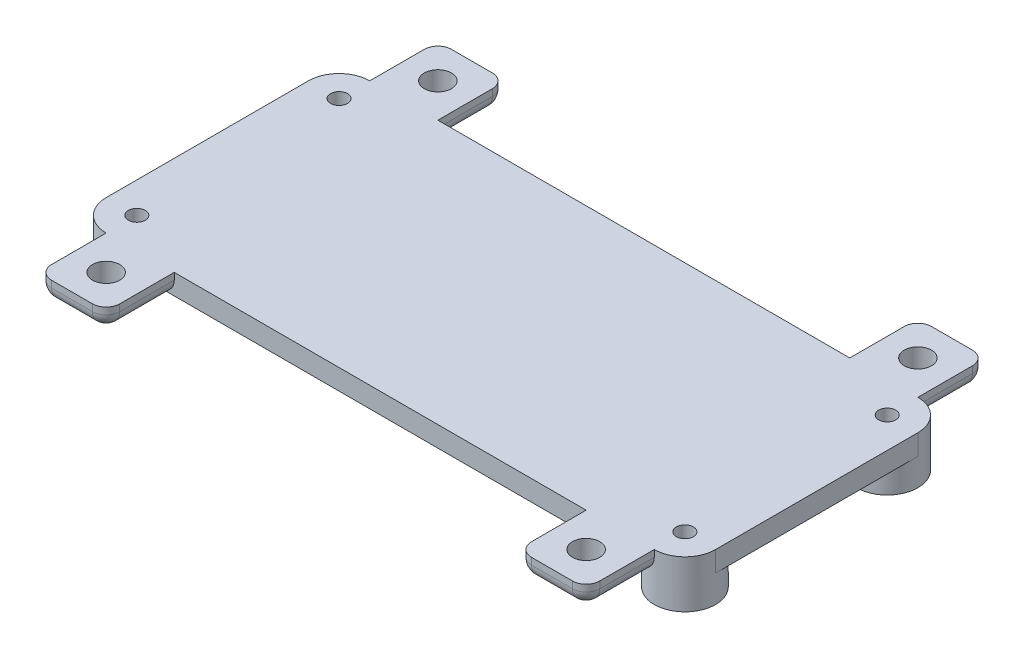
from build123d import *

# Parameters (mm, degrees)
SKETCH1_R           = 1.25
BOSS_EXTRUDE1_DEPTH = 4
BOSS_EXTRUDE2_DEPTH = 3
SKETCH1_3_R         = 1.25
CUT_EXTRUDE1_DEPTH  = 7
SKETCH3_W           = 10
SKETCH3_H           = 3
BOSS_EXTRUDE3_DEPTH = 10
BOSS_EXTRUDE4_START = -38.69
SKETCH3_2_W         = 10
SKETCH3_2_H         = 3
BOSS_EXTRUDE4_DEPTH = 10
FILLET1_R           = 2
FILLET2_R           = 2
CUT_EXTRUDE2_REACH  = 101.465
SKETCH4_R           = 2


with BuildPart() as part:
    # Sketch1 → Boss-Extrude1 (new body)
    # profile 1 of 8: a face of its own
    with BuildSketch(Plane(origin=(0, 0, 0), x_dir=(1, 0, 0), z_dir=(0, 1, 0))):
        with BuildLine():
            ThreePointArc((-78.345, -2.875), (-78.612488616, -1.346652073), (-79.383154394, 0))
            Line((-79.383154394, 0), (-85.4, 0))
            Line((-85.4, 0), (-85.4, -6.579318426))
            ThreePointArc((-85.4, -6.579318426), (-80.753051148, -6.859187496), (-78.345, -2.875))
        make_face()
        with Locations(Location((-82.845, -2.875, 0), (0, 0, 270))):
            Circle(SKETCH1_R, mode=Mode.SUBTRACT)
    # profile 2 of 8: a face of its own
    with BuildSketch(Plane(origin=(0, 0, 0), x_dir=(1, 0, 0), z_dir=(0, 1, 0))):
        with BuildLine():
            Line((-85.4, 0), (-79.383154394, 0))
            ThreePointArc((-79.383154394, 0), (-86.165760451, 0.161865164), (-85.4, -6.579318426))
            Line((-85.4, -6.579318426), (-85.4, 0))
        make_face()
    # profile 3 of 8: a face of its own
    with BuildSketch(Plane(origin=(0, 0, 0), x_dir=(1, 0, 0), z_dir=(0, 1, 0))):
        with BuildLine():
            Line((-85.4, -35.22), (-85.4, -28.860681574))
            ThreePointArc((-85.4, -28.860681574), (-86.070046249, -35.703323867), (-79.211685398, -35.22))
            Line((-79.211685398, -35.22), (-85.4, -35.22))
        make_face()
    # profile 4 of 8: a face of its own
    with BuildSketch(Plane(origin=(0, 0, 0), x_dir=(1, 0, 0), z_dir=(0, 1, 0))):
        with BuildLine():
            ThreePointArc((-78.345, -32.565), (-80.753051148, -28.580812504), (-85.4, -28.860681574))
            Line((-85.4, -28.860681574), (-85.4, -35.22))
            Line((-85.4, -35.22), (-79.211685398, -35.22))
            ThreePointArc((-79.211685398, -35.22), (-78.567154999, -33.961439094), (-78.345, -32.565))
        make_face()
        with Locations(Location((-82.845, -32.565, 0), (0, 0, 270))):
            Circle(SKETCH1_R, mode=Mode.SUBTRACT)
    # profile 5 of 8: a face of its own
    with BuildSketch(Plane(origin=(0, 0, 0), x_dir=(1, 0, 0), z_dir=(0, 1, 0))):
        with BuildLine():
            Line((0, -35.22), (0, -28.755278882))
            ThreePointArc((0, -28.755278882), (-5.68612603, -29.496044241), (-6.028314602, -35.22))
            Line((-6.028314602, -35.22), (0, -35.22))
        make_face()
        with Locations(Location((-2.395, -32.565, 0), (0, 0, 270))):
            Circle(SKETCH1_R, mode=Mode.SUBTRACT)
    # profile 6 of 8: a face of its own
    with BuildSketch(Plane(origin=(0, 0, 0), x_dir=(1, 0, 0), z_dir=(0, 1, 0))):
        with BuildLine():
            ThreePointArc((2.105, -32.565), (1.543749802, -30.388707281), (0, -28.755278882))
            Line((0, -28.755278882), (0, -35.22))
            Line((0, -35.22), (-6.028314602, -35.22))
            ThreePointArc((-6.028314602, -35.22), (-0.998560906, -36.842845001), (2.105, -32.565))
        make_face()
    # profile 7 of 8: a face of its own
    with BuildSketch(Plane(origin=(0, 0, 0), x_dir=(1, 0, 0), z_dir=(0, 1, 0))):
        with BuildLine():
            Line((0, -6.684721118), (0, 0))
            Line((0, 0), (-5.856845606, 0))
            ThreePointArc((-5.856845606, 0), (-5.779658623, -5.840482424), (0, -6.684721118))
        make_face()
        with Locations(Location((-2.395, -2.875, 0), (0, 0, 270))):
            Circle(SKETCH1_R, mode=Mode.SUBTRACT)
    # profile 8 of 8: a face of its own
    with BuildSketch(Plane(origin=(0, 0, 0), x_dir=(1, 0, 0), z_dir=(0, 1, 0))):
        with BuildLine():
            Line((-5.856845606, 0), (0, 0))
            Line((0, 0), (0, -6.684721118))
            ThreePointArc((0, -6.684721118), (1.543749802, -5.051292719), (2.105, -2.875))
            ThreePointArc((2.105, -2.875), (-0.866652073, 1.357511384), (-5.856845606, 0))
        make_face()
    extrude(amount=BOSS_EXTRUDE1_DEPTH)

    # Sketch2 → Boss-Extrude2 (add)
    with BuildSketch(Plane(origin=(0, 4, 0), x_dir=(1, 0, 0), z_dir=(0, 1, 0))):
        with BuildLine():
            Line((-2.395, 1.625), (-82.845, 1.625))
            ThreePointArc((-82.845, 1.625), (-79.663019485, 0.306980515), (-78.345, -2.875))
            Line((-78.345, -2.875), (-6.895, -2.875))
            ThreePointArc((-6.895, -2.875), (-5.576980515, 0.306980515), (-2.395, 1.625))
        make_face()
        with BuildLine():
            ThreePointArc((-78.345, -2.875), (-79.663019485, 0.306980515), (-82.845, 1.625))
            Line((-82.845, 1.625), (-82.845, -1.625))
            ThreePointArc((-82.845, -1.625), (-81.961116524, -1.991116524), (-81.595, -2.875))
            Line((-81.595, -2.875), (-78.345, -2.875))
        make_face()
        with BuildLine():
            Line((-82.845, -1.625), (-82.845, 1.625))
            ThreePointArc((-82.845, 1.625), (-86.026980515, 0.306980515), (-87.345, -2.875))
            Line((-87.345, -2.875), (-84.095, -2.875))
            ThreePointArc((-84.095, -2.875), (-83.728883476, -1.991116524), (-82.845, -1.625))
        make_face()
        with BuildLine():
            ThreePointArc((-82.845, -7.375), (-79.663019485, -6.056980515), (-78.345, -2.875))
            Line((-78.345, -2.875), (-81.595, -2.875))
            ThreePointArc((-81.595, -2.875), (-81.961116524, -3.758883476), (-82.845, -4.125))
            Line((-82.845, -4.125), (-82.845, -7.375))
        make_face()
        with BuildLine():
            Line((-84.095, -2.875), (-87.345, -2.875))
            ThreePointArc((-87.345, -2.875), (-86.026980515, -6.056980515), (-82.845, -7.375))
            Line((-82.845, -7.375), (-82.845, -4.125))
            ThreePointArc((-82.845, -4.125), (-83.728883476, -3.758883476), (-84.095, -2.875))
        make_face()
        with BuildLine():
            ThreePointArc((-78.345, -2.875), (-79.663019485, 0.306980515), (-82.845, 1.625))
            Line((-82.845, 1.625), (-82.845, -1.625))
            ThreePointArc((-82.845, -1.625), (-81.961116524, -1.991116524), (-81.595, -2.875))
            Line((-81.595, -2.875), (-78.345, -2.875))
        make_face()
        with BuildLine():
            Line((-82.845, -1.625), (-82.845, 1.625))
            ThreePointArc((-82.845, 1.625), (-86.026980515, 0.306980515), (-87.345, -2.875))
            Line((-87.345, -2.875), (-84.095, -2.875))
            ThreePointArc((-84.095, -2.875), (-83.728883476, -1.991116524), (-82.845, -1.625))
        make_face()
        with BuildLine():
            ThreePointArc((-82.845, -7.375), (-79.663019485, -6.056980515), (-78.345, -2.875))
            Line((-78.345, -2.875), (-81.595, -2.875))
            ThreePointArc((-81.595, -2.875), (-81.961116524, -3.758883476), (-82.845, -4.125))
            Line((-82.845, -4.125), (-82.845, -7.375))
        make_face()
        with BuildLine():
            Line((-84.095, -2.875), (-87.345, -2.875))
            ThreePointArc((-87.345, -2.875), (-86.026980515, -6.056980515), (-82.845, -7.375))
            Line((-82.845, -7.375), (-82.845, -4.125))
            ThreePointArc((-82.845, -4.125), (-83.728883476, -3.758883476), (-84.095, -2.875))
        make_face()
        with BuildLine():
            ThreePointArc((-78.345, -2.875), (-79.663019485, 0.306980515), (-82.845, 1.625))
            Line((-82.845, 1.625), (-82.845, -1.625))
            ThreePointArc((-82.845, -1.625), (-81.961116524, -1.991116524), (-81.595, -2.875))
            Line((-81.595, -2.875), (-78.345, -2.875))
        make_face()
        with BuildLine():
            Line((-82.845, -1.625), (-82.845, 1.625))
            ThreePointArc((-82.845, 1.625), (-86.026980515, 0.306980515), (-87.345, -2.875))
            Line((-87.345, -2.875), (-84.095, -2.875))
            ThreePointArc((-84.095, -2.875), (-83.728883476, -1.991116524), (-82.845, -1.625))
        make_face()
        with BuildLine():
            ThreePointArc((-82.845, -7.375), (-79.663019485, -6.056980515), (-78.345, -2.875))
            Line((-78.345, -2.875), (-81.595, -2.875))
            ThreePointArc((-81.595, -2.875), (-81.961116524, -3.758883476), (-82.845, -4.125))
            Line((-82.845, -4.125), (-82.845, -7.375))
        make_face()
        with BuildLine():
            Line((-84.095, -2.875), (-87.345, -2.875))
            ThreePointArc((-87.345, -2.875), (-86.026980515, -6.056980515), (-82.845, -7.375))
            Line((-82.845, -7.375), (-82.845, -4.125))
            ThreePointArc((-82.845, -4.125), (-83.728883476, -3.758883476), (-84.095, -2.875))
        make_face()
        with BuildLine():
            ThreePointArc((-78.345, -2.875), (-79.663019485, 0.306980515), (-82.845, 1.625))
            Line((-82.845, 1.625), (-82.845, -1.625))
            ThreePointArc((-82.845, -1.625), (-81.961116524, -1.991116524), (-81.595, -2.875))
            Line((-81.595, -2.875), (-78.345, -2.875))
        make_face()
        with BuildLine():
            Line((-82.845, -1.625), (-82.845, 1.625))
            ThreePointArc((-82.845, 1.625), (-86.026980515, 0.306980515), (-87.345, -2.875))
            Line((-87.345, -2.875), (-84.095, -2.875))
            ThreePointArc((-84.095, -2.875), (-83.728883476, -1.991116524), (-82.845, -1.625))
        make_face()
        with BuildLine():
            ThreePointArc((-82.845, -7.375), (-79.663019485, -6.056980515), (-78.345, -2.875))
            Line((-78.345, -2.875), (-81.595, -2.875))
            ThreePointArc((-81.595, -2.875), (-81.961116524, -3.758883476), (-82.845, -4.125))
            Line((-82.845, -4.125), (-82.845, -7.375))
        make_face()
        with BuildLine():
            Line((-84.095, -2.875), (-87.345, -2.875))
            ThreePointArc((-87.345, -2.875), (-86.026980515, -6.056980515), (-82.845, -7.375))
            Line((-82.845, -7.375), (-82.845, -4.125))
            ThreePointArc((-82.845, -4.125), (-83.728883476, -3.758883476), (-84.095, -2.875))
        make_face()
        with BuildLine():
            ThreePointArc((-82.845, -7.375), (-86.026980515, -6.056980515), (-87.345, -2.875))
            Line((-87.345, -2.875), (-87.345, -32.565))
            ThreePointArc((-87.345, -32.565), (-86.026980515, -29.383019485), (-82.845, -28.065))
            Line((-82.845, -28.065), (-82.845, -7.375))
        make_face()
        with BuildLine():
            Line((-6.895, -2.875), (-78.345, -2.875))
            ThreePointArc((-78.345, -2.875), (-79.663019485, -6.056980515), (-82.845, -7.375))
            Line((-82.845, -7.375), (-82.845, -28.065))
            ThreePointArc((-82.845, -28.065), (-79.663019485, -29.383019485), (-78.345, -32.565))
            Line((-78.345, -32.565), (-6.895, -32.565))
            ThreePointArc((-6.895, -32.565), (-5.576980515, -29.383019485), (-2.395, -28.065))
            Line((-2.395, -28.065), (-2.395, -7.375))
            ThreePointArc((-2.395, -7.375), (-5.576980515, -6.056980515), (-6.895, -2.875))
        make_face()
        with BuildLine():
            ThreePointArc((-82.845, -28.065), (-86.026980515, -29.383019485), (-87.345, -32.565))
            Line((-87.345, -32.565), (-82.845, -32.565))
            Line((-82.845, -32.565), (-82.845, -28.065))
        make_face()
        with BuildLine():
            Line((-82.845, -32.565), (-87.345, -32.565))
            ThreePointArc((-87.345, -32.565), (-86.026980515, -35.746980515), (-82.845, -37.065))
            Line((-82.845, -37.065), (-82.845, -32.565))
        make_face()
        with BuildLine():
            ThreePointArc((-78.345, -32.565), (-79.663019485, -29.383019485), (-82.845, -28.065))
            Line((-82.845, -28.065), (-82.845, -32.565))
            Line((-82.845, -32.565), (-78.345, -32.565))
        make_face()
        with BuildLine():
            Line((-78.345, -32.565), (-82.845, -32.565))
            Line((-82.845, -32.565), (-82.845, -37.065))
            ThreePointArc((-82.845, -37.065), (-79.663019485, -35.746980515), (-78.345, -32.565))
        make_face()
        with BuildLine():
            ThreePointArc((-82.845, -28.065), (-86.026980515, -29.383019485), (-87.345, -32.565))
            Line((-87.345, -32.565), (-82.845, -32.565))
            Line((-82.845, -32.565), (-82.845, -28.065))
        make_face()
        with BuildLine():
            Line((-82.845, -32.565), (-87.345, -32.565))
            ThreePointArc((-87.345, -32.565), (-86.026980515, -35.746980515), (-82.845, -37.065))
            Line((-82.845, -37.065), (-82.845, -32.565))
        make_face()
        with BuildLine():
            ThreePointArc((-78.345, -32.565), (-79.663019485, -29.383019485), (-82.845, -28.065))
            Line((-82.845, -28.065), (-82.845, -32.565))
            Line((-82.845, -32.565), (-78.345, -32.565))
        make_face()
        with BuildLine():
            Line((-78.345, -32.565), (-82.845, -32.565))
            Line((-82.845, -32.565), (-82.845, -37.065))
            ThreePointArc((-82.845, -37.065), (-79.663019485, -35.746980515), (-78.345, -32.565))
        make_face()
        with BuildLine():
            ThreePointArc((-82.845, -28.065), (-86.026980515, -29.383019485), (-87.345, -32.565))
            Line((-87.345, -32.565), (-82.845, -32.565))
            Line((-82.845, -32.565), (-82.845, -28.065))
        make_face()
        with BuildLine():
            Line((-82.845, -32.565), (-87.345, -32.565))
            ThreePointArc((-87.345, -32.565), (-86.026980515, -35.746980515), (-82.845, -37.065))
            Line((-82.845, -37.065), (-82.845, -32.565))
        make_face()
        with BuildLine():
            ThreePointArc((-78.345, -32.565), (-79.663019485, -29.383019485), (-82.845, -28.065))
            Line((-82.845, -28.065), (-82.845, -32.565))
            Line((-82.845, -32.565), (-78.345, -32.565))
        make_face()
        with BuildLine():
            Line((-78.345, -32.565), (-82.845, -32.565))
            Line((-82.845, -32.565), (-82.845, -37.065))
            ThreePointArc((-82.845, -37.065), (-79.663019485, -35.746980515), (-78.345, -32.565))
        make_face()
        with BuildLine():
            ThreePointArc((-82.845, -28.065), (-86.026980515, -29.383019485), (-87.345, -32.565))
            Line((-87.345, -32.565), (-82.845, -32.565))
            Line((-82.845, -32.565), (-82.845, -28.065))
        make_face()
        with BuildLine():
            Line((-82.845, -32.565), (-87.345, -32.565))
            ThreePointArc((-87.345, -32.565), (-86.026980515, -35.746980515), (-82.845, -37.065))
            Line((-82.845, -37.065), (-82.845, -32.565))
        make_face()
        with BuildLine():
            ThreePointArc((-78.345, -32.565), (-79.663019485, -29.383019485), (-82.845, -28.065))
            Line((-82.845, -28.065), (-82.845, -32.565))
            Line((-82.845, -32.565), (-78.345, -32.565))
        make_face()
        with BuildLine():
            Line((-78.345, -32.565), (-82.845, -32.565))
            Line((-82.845, -32.565), (-82.845, -37.065))
            ThreePointArc((-82.845, -37.065), (-79.663019485, -35.746980515), (-78.345, -32.565))
        make_face()
        with BuildLine():
            ThreePointArc((-78.345, -32.565), (-79.663019485, -35.746980515), (-82.845, -37.065))
            Line((-82.845, -37.065), (-2.395, -37.065))
            ThreePointArc((-2.395, -37.065), (-5.576980515, -35.746980515), (-6.895, -32.565))
            Line((-6.895, -32.565), (-78.345, -32.565))
        make_face()
        with BuildLine():
            ThreePointArc((-2.395, -37.065), (0.786980515, -35.746980515), (2.105, -32.565))
            Line((2.105, -32.565), (-2.395, -32.565))
            Line((-2.395, -32.565), (-2.395, -37.065))
        make_face()
        with BuildLine():
            Line((-2.395, -32.565), (2.105, -32.565))
            ThreePointArc((2.105, -32.565), (0.786980515, -29.383019485), (-2.395, -28.065))
            Line((-2.395, -28.065), (-2.395, -32.565))
        make_face()
        with BuildLine():
            Line((-2.395, -32.565), (-2.395, -28.065))
            ThreePointArc((-2.395, -28.065), (-5.576980515, -29.383019485), (-6.895, -32.565))
            Line((-6.895, -32.565), (-2.395, -32.565))
        make_face()
        with BuildLine():
            Line((-2.395, -37.065), (-2.395, -32.565))
            Line((-2.395, -32.565), (-6.895, -32.565))
            ThreePointArc((-6.895, -32.565), (-5.576980515, -35.746980515), (-2.395, -37.065))
        make_face()
        with BuildLine():
            ThreePointArc((-2.395, -37.065), (0.786980515, -35.746980515), (2.105, -32.565))
            Line((2.105, -32.565), (-2.395, -32.565))
            Line((-2.395, -32.565), (-2.395, -37.065))
        make_face()
        with BuildLine():
            Line((-2.395, -32.565), (2.105, -32.565))
            ThreePointArc((2.105, -32.565), (0.786980515, -29.383019485), (-2.395, -28.065))
            Line((-2.395, -28.065), (-2.395, -32.565))
        make_face()
        with BuildLine():
            Line((-2.395, -32.565), (-2.395, -28.065))
            ThreePointArc((-2.395, -28.065), (-5.576980515, -29.383019485), (-6.895, -32.565))
            Line((-6.895, -32.565), (-2.395, -32.565))
        make_face()
        with BuildLine():
            Line((-2.395, -37.065), (-2.395, -32.565))
            Line((-2.395, -32.565), (-6.895, -32.565))
            ThreePointArc((-6.895, -32.565), (-5.576980515, -35.746980515), (-2.395, -37.065))
        make_face()
        with BuildLine():
            ThreePointArc((-2.395, -37.065), (0.786980515, -35.746980515), (2.105, -32.565))
            Line((2.105, -32.565), (-2.395, -32.565))
            Line((-2.395, -32.565), (-2.395, -37.065))
        make_face()
        with BuildLine():
            Line((-2.395, -32.565), (2.105, -32.565))
            ThreePointArc((2.105, -32.565), (0.786980515, -29.383019485), (-2.395, -28.065))
            Line((-2.395, -28.065), (-2.395, -32.565))
        make_face()
        with BuildLine():
            Line((-2.395, -32.565), (-2.395, -28.065))
            ThreePointArc((-2.395, -28.065), (-5.576980515, -29.383019485), (-6.895, -32.565))
            Line((-6.895, -32.565), (-2.395, -32.565))
        make_face()
        with BuildLine():
            Line((-2.395, -37.065), (-2.395, -32.565))
            Line((-2.395, -32.565), (-6.895, -32.565))
            ThreePointArc((-6.895, -32.565), (-5.576980515, -35.746980515), (-2.395, -37.065))
        make_face()
        with BuildLine():
            ThreePointArc((-2.395, -37.065), (0.786980515, -35.746980515), (2.105, -32.565))
            Line((2.105, -32.565), (-2.395, -32.565))
            Line((-2.395, -32.565), (-2.395, -37.065))
        make_face()
        with BuildLine():
            Line((-2.395, -32.565), (2.105, -32.565))
            ThreePointArc((2.105, -32.565), (0.786980515, -29.383019485), (-2.395, -28.065))
            Line((-2.395, -28.065), (-2.395, -32.565))
        make_face()
        with BuildLine():
            Line((-2.395, -32.565), (-2.395, -28.065))
            ThreePointArc((-2.395, -28.065), (-5.576980515, -29.383019485), (-6.895, -32.565))
            Line((-6.895, -32.565), (-2.395, -32.565))
        make_face()
        with BuildLine():
            Line((-2.395, -37.065), (-2.395, -32.565))
            Line((-2.395, -32.565), (-6.895, -32.565))
            ThreePointArc((-6.895, -32.565), (-5.576980515, -35.746980515), (-2.395, -37.065))
        make_face()
        with BuildLine():
            Line((2.105, -32.565), (2.105, -2.875))
            ThreePointArc((2.105, -2.875), (0.786980515, -6.056980515), (-2.395, -7.375))
            Line((-2.395, -7.375), (-2.395, -28.065))
            ThreePointArc((-2.395, -28.065), (0.786980515, -29.383019485), (2.105, -32.565))
        make_face()
        with BuildLine():
            ThreePointArc((2.105, -2.875), (0.786980515, 0.306980515), (-2.395, 1.625))
            Line((-2.395, 1.625), (-2.395, -2.875))
            Line((-2.395, -2.875), (2.105, -2.875))
        make_face()
        with BuildLine():
            Line((-2.395, -2.875), (-2.395, 1.625))
            ThreePointArc((-2.395, 1.625), (-5.576980515, 0.306980515), (-6.895, -2.875))
            Line((-6.895, -2.875), (-2.395, -2.875))
        make_face()
        with BuildLine():
            Line((2.105, -2.875), (-2.395, -2.875))
            Line((-2.395, -2.875), (-2.395, -7.375))
            ThreePointArc((-2.395, -7.375), (0.786980515, -6.056980515), (2.105, -2.875))
        make_face()
        with BuildLine():
            Line((-2.395, -7.375), (-2.395, -2.875))
            Line((-2.395, -2.875), (-6.895, -2.875))
            ThreePointArc((-6.895, -2.875), (-5.576980515, -6.056980515), (-2.395, -7.375))
        make_face()
        with BuildLine():
            ThreePointArc((2.105, -2.875), (0.786980515, 0.306980515), (-2.395, 1.625))
            Line((-2.395, 1.625), (-2.395, -2.875))
            Line((-2.395, -2.875), (2.105, -2.875))
        make_face()
        with BuildLine():
            Line((-2.395, -2.875), (-2.395, 1.625))
            ThreePointArc((-2.395, 1.625), (-5.576980515, 0.306980515), (-6.895, -2.875))
            Line((-6.895, -2.875), (-2.395, -2.875))
        make_face()
        with BuildLine():
            Line((2.105, -2.875), (-2.395, -2.875))
            Line((-2.395, -2.875), (-2.395, -7.375))
            ThreePointArc((-2.395, -7.375), (0.786980515, -6.056980515), (2.105, -2.875))
        make_face()
        with BuildLine():
            Line((-2.395, -7.375), (-2.395, -2.875))
            Line((-2.395, -2.875), (-6.895, -2.875))
            ThreePointArc((-6.895, -2.875), (-5.576980515, -6.056980515), (-2.395, -7.375))
        make_face()
        with BuildLine():
            ThreePointArc((2.105, -2.875), (0.786980515, 0.306980515), (-2.395, 1.625))
            Line((-2.395, 1.625), (-2.395, -2.875))
            Line((-2.395, -2.875), (2.105, -2.875))
        make_face()
        with BuildLine():
            Line((-2.395, -2.875), (-2.395, 1.625))
            ThreePointArc((-2.395, 1.625), (-5.576980515, 0.306980515), (-6.895, -2.875))
            Line((-6.895, -2.875), (-2.395, -2.875))
        make_face()
        with BuildLine():
            Line((2.105, -2.875), (-2.395, -2.875))
            Line((-2.395, -2.875), (-2.395, -7.375))
            ThreePointArc((-2.395, -7.375), (0.786980515, -6.056980515), (2.105, -2.875))
        make_face()
        with BuildLine():
            Line((-2.395, -7.375), (-2.395, -2.875))
            Line((-2.395, -2.875), (-6.895, -2.875))
            ThreePointArc((-6.895, -2.875), (-5.576980515, -6.056980515), (-2.395, -7.375))
        make_face()
        with BuildLine():
            ThreePointArc((2.105, -2.875), (0.786980515, 0.306980515), (-2.395, 1.625))
            Line((-2.395, 1.625), (-2.395, -2.875))
            Line((-2.395, -2.875), (2.105, -2.875))
        make_face()
        with BuildLine():
            Line((-2.395, -2.875), (-2.395, 1.625))
            ThreePointArc((-2.395, 1.625), (-5.576980515, 0.306980515), (-6.895, -2.875))
            Line((-6.895, -2.875), (-2.395, -2.875))
        make_face()
        with BuildLine():
            Line((2.105, -2.875), (-2.395, -2.875))
            Line((-2.395, -2.875), (-2.395, -7.375))
            ThreePointArc((-2.395, -7.375), (0.786980515, -6.056980515), (2.105, -2.875))
        make_face()
        with BuildLine():
            Line((-2.395, -7.375), (-2.395, -2.875))
            Line((-2.395, -2.875), (-6.895, -2.875))
            ThreePointArc((-6.895, -2.875), (-5.576980515, -6.056980515), (-2.395, -7.375))
        make_face()
    extrude(amount=BOSS_EXTRUDE2_DEPTH)

    # Sketch1<3> → Cut-Extrude1 (cut)
    with BuildSketch(Plane(origin=(0, 0, 0), x_dir=(1, 0, 0), z_dir=(0, 1, 0))):
        with Locations(Location((-82.845, -2.875, 0), (0, 0, 270))):
            Circle(SKETCH1_3_R)
        with Locations(Location((-2.395, -2.875, 0), (0, 0, 270))):
            Circle(SKETCH1_3_R)
        with Locations(Location((-2.395, -32.565, 0), (0, 0, 270))):
            Circle(SKETCH1_3_R)
        with Locations(Location((-82.845, -32.565, 0), (0, 0, 270))):
            Circle(SKETCH1_3_R)
    extrude(amount=CUT_EXTRUDE1_DEPTH, mode=Mode.SUBTRACT)

    # Sketch3 → Boss-Extrude3 (add)
    with BuildSketch(Plane(origin=(0, 0, -1.625), x_dir=(-1, 0, 0), z_dir=(0, 0, -1))):
        with Locations((77.845, 5.5)):
            Rectangle(SKETCH3_W, SKETCH3_H)
        with Locations((7.395, 5.5)):
            Rectangle(SKETCH3_W, SKETCH3_H)
    extrude(amount=BOSS_EXTRUDE3_DEPTH)

    # Sketch3<2> → Boss-Extrude4 (add)
    with BuildSketch(Plane(origin=(0, 0, -1.625), x_dir=(-1, 0, 0), z_dir=(0, 0, -1)).offset(BOSS_EXTRUDE4_START)):
        with Locations((77.845, 5.5)):
            Rectangle(SKETCH3_2_W, SKETCH3_2_H)
        with Locations((7.395, 5.5)):
            Rectangle(SKETCH3_2_W, SKETCH3_2_H)
    extrude(amount=-BOSS_EXTRUDE4_DEPTH)

    # Fillet1
    fillet1_edges = [part.edges().sort_by_distance(p)[0] for p in [
        (-72.845, 5.5, 47.065),
        (-82.845, 5.5, 47.065),
        (-12.395, 5.5, 47.065),
        (-2.395, 5.5, 47.065),
        (-82.845, 5.5, -11.625),
        (-72.845, 5.5, -11.625),
        (-2.395, 5.5, -11.625),
        (-12.395, 5.5, -11.625),
    ]]
    fillet(fillet1_edges, radius=FILLET1_R)

    # Fillet2
    # the kernel refuses this fillet: 2 mm, written as the material it takes off along each edge
    with BuildSketch(Plane(origin=(-72.845, 4, 37.065), x_dir=(-1, 0, 0), z_dir=(0, 0, 1)), Plane(origin=(-12.395, 4, -1.625), x_dir=(1, 0, 0), z_dir=(0, 0, -1))) as fillet2_piece_1:
        with BuildLine():
            CenterArc((FILLET2_R, -FILLET2_R), FILLET2_R, 90, 90)
            Line((0, -FILLET2_R), (0, 0))
            Line((0, 0), (FILLET2_R, 0))
        make_face()
    extrude(amount=8, mode=Mode.SUBTRACT)
    with BuildSketch(Plane(origin=(-2.395, 4, 32.065), x_dir=(-1, 0, 0), z_dir=(0, 0, 1))) as fillet2_piece_2_section:
        with BuildLine():
            CenterArc((FILLET2_R, -FILLET2_R), FILLET2_R, 90, 90)
            Line((0, -FILLET2_R), (0, 0))
            Line((0, 0), (FILLET2_R, 0))
        make_face()
    fillet2_piece_2 = extrude(amount=13, mode=Mode.PRIVATE)
    fillet2_piece_2 = fillet2_piece_2 - Plane(origin=(-2.395, 4.450962193, 32.565), x_dir=(0.5322222222222478, 0, -0.8466046929782591), z_dir=(0, -1, 0)) * Cylinder(4.5, 34, mode=Mode.PRIVATE)
    add(fillet2_piece_2, mode=Mode.SUBTRACT)
    with BuildSketch(Plane(origin=(-4.395, 4, 47.065), x_dir=(0, 0, -1), z_dir=(-1, 0, 0)), Plane(origin=(-80.845, 4, -11.625), x_dir=(0, 0, 1), z_dir=(1, 0, 0))) as fillet2_piece_3:
        with BuildLine():
            CenterArc((FILLET2_R, -FILLET2_R), FILLET2_R, 90, 90)
            Line((0, -FILLET2_R), (0, 0))
            Line((0, 0), (FILLET2_R, 0))
        make_face()
    extrude(amount=6, mode=Mode.SUBTRACT)
    with BuildSketch(Plane(origin=(-12.395, 4, 37.065), x_dir=(1, 0, 0), z_dir=(0, 0, 1)), Plane(origin=(-72.845, 4, -1.625), x_dir=(-1, 0, 0), z_dir=(0, 0, -1))) as fillet2_piece_4:
        with BuildLine():
            CenterArc((FILLET2_R, FILLET2_R), FILLET2_R, 180, 90)
            Line((0, FILLET2_R), (0, 0))
            Line((0, 0), (FILLET2_R, 0))
        make_face()
    extrude(amount=8, mode=Mode.SUBTRACT)
    with BuildSketch(Plane(origin=(-80.845, 4, 47.065), x_dir=(0, 0, -1), z_dir=(1, 0, 0)), Plane(origin=(-4.395, 4, -11.625), x_dir=(0, 0, 1), z_dir=(-1, 0, 0))) as fillet2_piece_5:
        with BuildLine():
            CenterArc((FILLET2_R, FILLET2_R), FILLET2_R, 180, 90)
            Line((0, FILLET2_R), (0, 0))
            Line((0, 0), (FILLET2_R, 0))
        make_face()
    extrude(amount=6, mode=Mode.SUBTRACT)
    with BuildSketch(Plane(origin=(-82.845, 4, 32.065), x_dir=(1, 0, 0), z_dir=(0, 0, 1))) as fillet2_piece_6_section:
        with BuildLine():
            CenterArc((FILLET2_R, FILLET2_R), FILLET2_R, 180, 90)
            Line((0, FILLET2_R), (0, 0))
            Line((0, 0), (FILLET2_R, 0))
        make_face()
    fillet2_piece_6 = extrude(amount=13, mode=Mode.PRIVATE)
    fillet2_piece_6 = fillet2_piece_6 - Plane(origin=(-82.845, 4.450962196, 32.565), x_dir=(-0.5677777777777745, 0, -0.8231818724083592), z_dir=(0, -1, 0)) * Cylinder(4.5, 34, mode=Mode.PRIVATE)
    add(fillet2_piece_6, mode=Mode.SUBTRACT)
    with BuildSketch(Plane(origin=(-82.845, 4, 3.375), x_dir=(1, 0, 0), z_dir=(0, 0, -1))) as fillet2_piece_7_section:
        with BuildLine():
            CenterArc((FILLET2_R, -FILLET2_R), FILLET2_R, 90, 90)
            Line((0, -FILLET2_R), (0, 0))
            Line((0, 0), (FILLET2_R, 0))
        make_face()
    fillet2_piece_7 = extrude(amount=13, mode=Mode.PRIVATE)
    fillet2_piece_7 = fillet2_piece_7 - Plane(origin=(-82.845, 4.450962193, 2.875), x_dir=(-0.567777777777785, 0, 0.823181872408352), z_dir=(0, -1, 0)) * Cylinder(4.5, 34, mode=Mode.PRIVATE)
    add(fillet2_piece_7, mode=Mode.SUBTRACT)
    with BuildSketch(Plane(origin=(-2.395, 4, 3.375), x_dir=(-1, 0, 0), z_dir=(0, 0, -1))) as fillet2_piece_8_section:
        with BuildLine():
            CenterArc((FILLET2_R, FILLET2_R), FILLET2_R, 180, 90)
            Line((0, FILLET2_R), (0, 0))
            Line((0, 0), (FILLET2_R, 0))
        make_face()
    fillet2_piece_8 = extrude(amount=13, mode=Mode.PRIVATE)
    fillet2_piece_8 = fillet2_piece_8 - Plane(origin=(-2.395, 4.450962196, 2.875), x_dir=(-0.7692990235625408, 0, -0.638888888888922), z_dir=(0, -1, 0)) * Cylinder(4.5, 34, mode=Mode.PRIVATE)
    add(fillet2_piece_8, mode=Mode.SUBTRACT)
    with BuildSketch(Plane(origin=(-80.845, 4, -9.625), x_dir=(0, 0, -1), z_dir=(1, 0, 0))) as fillet2_piece_9:
        with BuildLine():
            CenterArc((2 - FILLET2_R, FILLET2_R), FILLET2_R, 270, 90)
            Line((2, FILLET2_R), (2, 0))
            Line((2, 0), (2 - FILLET2_R, 0))
        make_face()
    revolve(axis=Axis((-80.845, 4, -9.625), (0, 1, 0)), revolution_arc=90, mode=Mode.SUBTRACT)
    with BuildSketch(Plane(origin=(-74.845, 4, -9.625), x_dir=(1, 0, 0), z_dir=(0, 0, 1))) as fillet2_piece_10:
        with BuildLine():
            CenterArc((2 - FILLET2_R, FILLET2_R), FILLET2_R, 270, 90)
            Line((2, FILLET2_R), (2, 0))
            Line((2, 0), (2 - FILLET2_R, 0))
        make_face()
    revolve(axis=Axis((-74.845, 4, -9.625), (0, 1, 0)), revolution_arc=90, mode=Mode.SUBTRACT)
    with BuildSketch(Plane(origin=(-10.395, 4, -9.625), x_dir=(0, 0, -1), z_dir=(1, 0, 0))) as fillet2_piece_11:
        with BuildLine():
            CenterArc((2 - FILLET2_R, FILLET2_R), FILLET2_R, 270, 90)
            Line((2, FILLET2_R), (2, 0))
            Line((2, 0), (2 - FILLET2_R, 0))
        make_face()
    revolve(axis=Axis((-10.395, 4, -9.625), (0, 1, 0)), revolution_arc=90, mode=Mode.SUBTRACT)
    with BuildSketch(Plane(origin=(-4.395, 4, -9.625), x_dir=(1, 0, 0), z_dir=(0, 0, 1))) as fillet2_piece_12:
        with BuildLine():
            CenterArc((2 - FILLET2_R, FILLET2_R), FILLET2_R, 270, 90)
            Line((2, FILLET2_R), (2, 0))
            Line((2, 0), (2 - FILLET2_R, 0))
        make_face()
    revolve(axis=Axis((-4.395, 4, -9.625), (0, 1, 0)), revolution_arc=90, mode=Mode.SUBTRACT)
    with BuildSketch(Plane(origin=(-4.395, 4, 45.065), x_dir=(1, 0, 0), z_dir=(0, 0, -1))) as fillet2_piece_13:
        with BuildLine():
            CenterArc((2 - FILLET2_R, -FILLET2_R), FILLET2_R, 0, 90)
            Line((2, -FILLET2_R), (2, 0))
            Line((2, 0), (2 - FILLET2_R, 0))
        make_face()
    revolve(axis=Axis((-4.395, 4, 45.065), (0, -1, 0)), revolution_arc=90, mode=Mode.SUBTRACT)
    with BuildSketch(Plane(origin=(-10.395, 4, 45.065), x_dir=(-1, 0, 0), z_dir=(0, 0, -1))) as fillet2_piece_14:
        with BuildLine():
            CenterArc((2 - FILLET2_R, FILLET2_R), FILLET2_R, 270, 90)
            Line((2, FILLET2_R), (2, 0))
            Line((2, 0), (2 - FILLET2_R, 0))
        make_face()
    revolve(axis=Axis((-10.395, 4, 45.065), (0, 1, 0)), revolution_arc=90, mode=Mode.SUBTRACT)
    with BuildSketch(Plane(origin=(-80.845, 4, 45.065), x_dir=(-1, 0, 0), z_dir=(0, 0, -1))) as fillet2_piece_15:
        with BuildLine():
            CenterArc((2 - FILLET2_R, FILLET2_R), FILLET2_R, 270, 90)
            Line((2, FILLET2_R), (2, 0))
            Line((2, 0), (2 - FILLET2_R, 0))
        make_face()
    revolve(axis=Axis((-80.845, 4, 45.065), (0, 1, 0)), revolution_arc=90, mode=Mode.SUBTRACT)
    with BuildSketch(Plane(origin=(-74.845, 4, 45.065), x_dir=(1, 0, 0), z_dir=(0, 0, -1))) as fillet2_piece_16:
        with BuildLine():
            CenterArc((2 - FILLET2_R, -FILLET2_R), FILLET2_R, 0, 90)
            Line((2, -FILLET2_R), (2, 0))
            Line((2, 0), (2 - FILLET2_R, 0))
        make_face()
    revolve(axis=Axis((-74.845, 4, 45.065), (0, -1, 0)), revolution_arc=90, mode=Mode.SUBTRACT)

    # Sketch4 → Cut-Extrude2 (cut, up to next)
    with BuildSketch(Plane(origin=(0, 7, 0), x_dir=(1, 0, 0), z_dir=(0, 1, 0)), mode=Mode.PRIVATE) as cut_extrude2_sk1:
        with Locations(Location((-77.845, 6.625, 0), (0, 0, 270))):
            Circle(SKETCH4_R)
    cut_extrude2_tool1 = extrude(cut_extrude2_sk1.sketch, amount=-CUT_EXTRUDE2_REACH, mode=Mode.PRIVATE) & part.part
    # Sketch4 → Cut-Extrude2 (cut, up to next)
    with BuildSketch(Plane(origin=(0, 7, 0), x_dir=(1, 0, 0), z_dir=(0, 1, 0)), mode=Mode.PRIVATE) as cut_extrude2_sk2:
        with Locations(Location((-7.395, 6.625, 0), (0, 0, 270))):
            Circle(SKETCH4_R)
    cut_extrude2_tool2 = extrude(cut_extrude2_sk2.sketch, amount=-CUT_EXTRUDE2_REACH, mode=Mode.PRIVATE) & part.part
    # Sketch4 → Cut-Extrude2 (cut, up to next)
    with BuildSketch(Plane(origin=(0, 7, 0), x_dir=(1, 0, 0), z_dir=(0, 1, 0)), mode=Mode.PRIVATE) as cut_extrude2_sk3:
        with Locations(Location((-7.395, -42.065, 0), (0, 0, 270))):
            Circle(SKETCH4_R)
    cut_extrude2_tool3 = extrude(cut_extrude2_sk3.sketch, amount=-CUT_EXTRUDE2_REACH, mode=Mode.PRIVATE) & part.part
    # Sketch4 → Cut-Extrude2 (cut, up to next)
    with BuildSketch(Plane(origin=(0, 7, 0), x_dir=(1, 0, 0), z_dir=(0, 1, 0)), mode=Mode.PRIVATE) as cut_extrude2_sk4:
        with Locations(Location((-77.845, -42.065, 0), (0, 0, 270))):
            Circle(SKETCH4_R)
    cut_extrude2_tool4 = extrude(cut_extrude2_sk4.sketch, amount=-CUT_EXTRUDE2_REACH, mode=Mode.PRIVATE) & part.part
    add(cut_extrude2_tool1.solids().sort_by_distance((-77.845, 7, -6.625))[0], mode=Mode.SUBTRACT)
    add(cut_extrude2_tool2.solids().sort_by_distance((-7.395, 7, -6.625))[0], mode=Mode.SUBTRACT)
    add(cut_extrude2_tool3.solids().sort_by_distance((-7.395, 7, 42.065))[0], mode=Mode.SUBTRACT)
    add(cut_extrude2_tool4.solids().sort_by_distance((-77.845, 7, 42.065))[0], mode=Mode.SUBTRACT)


solid = part.part
